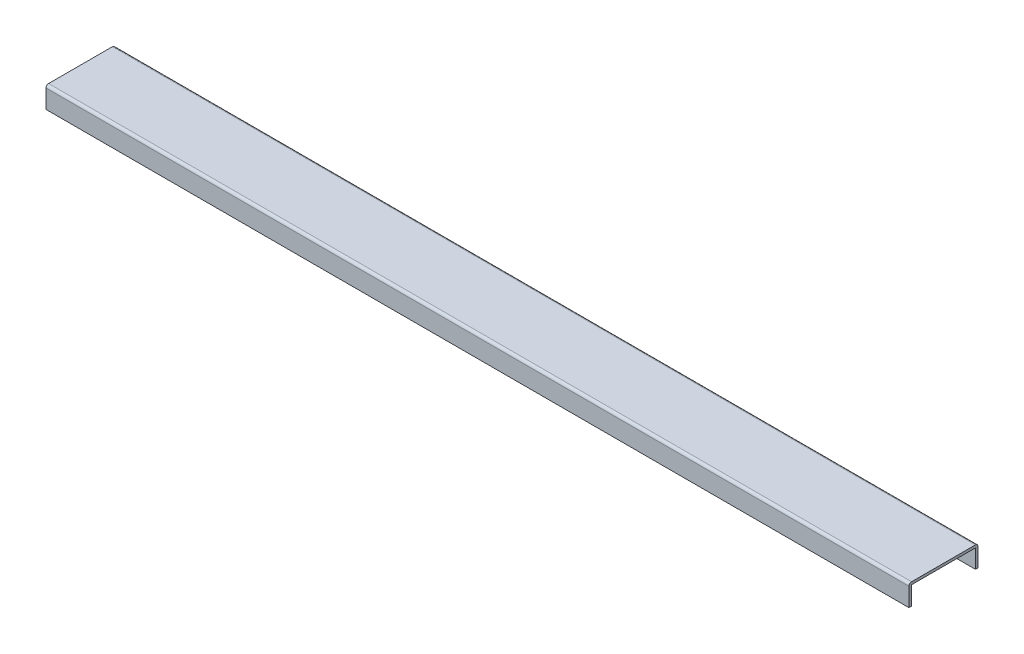
from build123d import *

# Parameters (mm, degrees)
SKETCH_1_W          = 74
SKETCH_1_H          = 74
EXTRUDE_1_DEPTH     = 1000
SKETCH_2_W          = 1000
SKETCH_2_H          = 55.462002837
CUT_EXTRUDE_1_DEPTH = 1007.379650033


with BuildPart() as part:
    # Эскиз1 → Вытянуть-Тонкостенный1 (new body)
    with BuildSketch(Plane(origin=(0, 0, 0), x_dir=(0, 0, -1), z_dir=(1, 0, 0))):
        with BuildLine():
            Line((0, 77), (0, 3))
            ThreePointArc((0, 3), (0.878679656, 0.878679656), (3, 0))
            Line((3, 0), (77, 0))
            ThreePointArc((77, 0), (79.121320344, 0.878679656), (80, 3))
            Line((80, 3), (80, 77))
            ThreePointArc((80, 77), (79.121320344, 79.121320344), (77, 80))
            Line((77, 80), (3, 80))
            ThreePointArc((3, 80), (0.878679656, 79.121320344), (0, 77))
        make_face()
        with Locations((40, 40)):
            Rectangle(SKETCH_1_W, SKETCH_1_H, mode=Mode.SUBTRACT)
    extrude(amount=EXTRUDE_1_DEPTH)

    # Эскиз2 → Вырез-Вытянуть1 (cut, through all)
    with BuildSketch(Plane(origin=(0, 0, -80), x_dir=(-1, 0, 0), z_dir=(0, 0, -1))):
        with Locations((-500, 27.731001418)):
            Rectangle(SKETCH_2_W, SKETCH_2_H)
    extrude(amount=-CUT_EXTRUDE_1_DEPTH, mode=Mode.SUBTRACT)


solid = part.part
